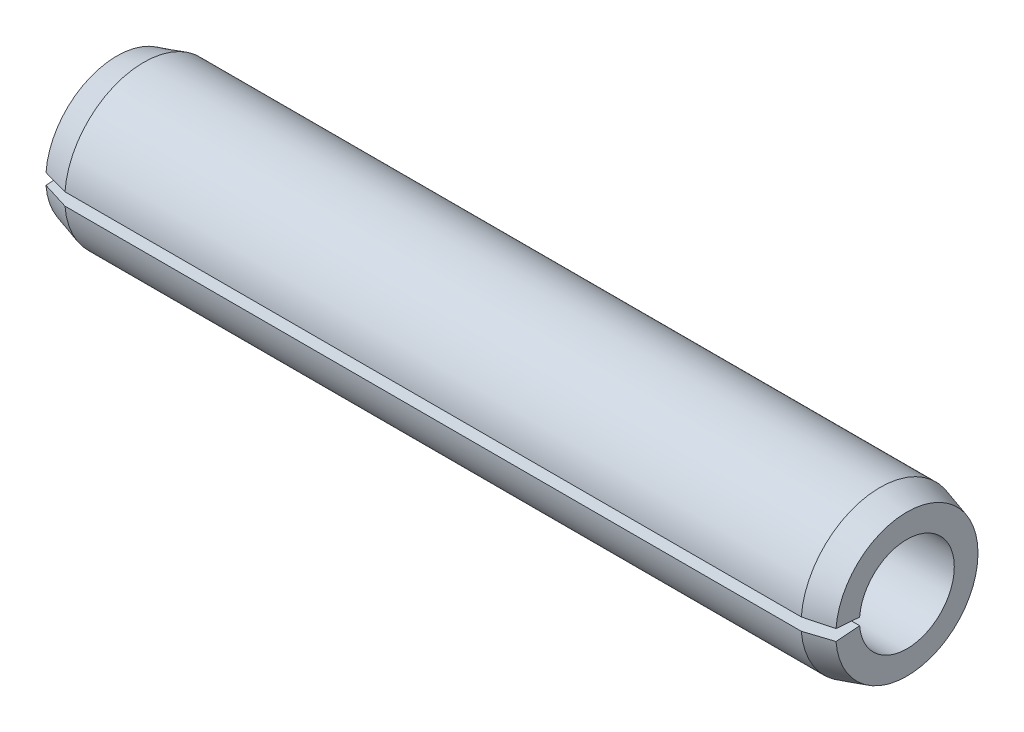
from build123d import *

# Parameters (mm, degrees)
GAP_DEPTH = 101.995049384


with BuildPart() as part:
    # BodySke → Body (revolve)
    with BuildSketch(Plane.XY):
        Polygon((0, 6), (100, 6), (100, 9), (96.6, 10), (3.4, 10), (0, 9), align=None)
    revolve(axis=Axis((-9.525, 0, 0), (1, 0, 0)))

    # GapSke → Gap (cut, through all)
    with BuildSketch(Plane(origin=(0, 0, 0), x_dir=(0, -1, 0), z_dir=(-1, 0, 0))):
        with BuildLine():
            Line((0, 0), (0.800282776, 10.168556804))
            ThreePointArc((0.800282776, 10.168556804), (0, 10.2), (-0.800282776, 10.168556804))
            Line((-0.800282776, 10.168556804), (0, 0))
        make_face()
    extrude(amount=-GAP_DEPTH, mode=Mode.SUBTRACT)


solid = part.part
